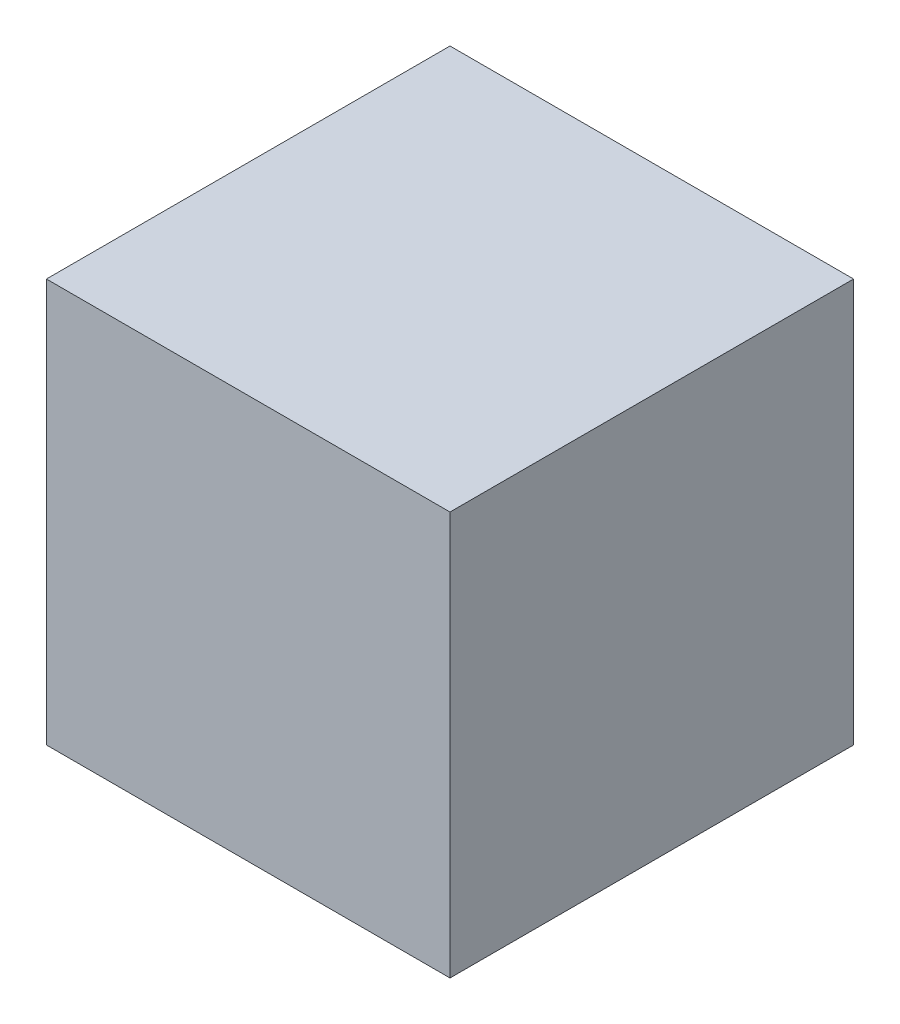
from build123d import *

# Parameters (mm, degrees)
SKETCH1_W           = 230
SKETCH1_H           = 230
BOSS_EXTRUDE1_DEPTH = 230


with BuildPart() as part:
    # Sketch1 → Boss-Extrude1 (new body)
    with BuildSketch(Plane(origin=(0, 0, 0), x_dir=(1, 0, 0), z_dir=(0, 1, 0))):
        Rectangle(SKETCH1_W, SKETCH1_H)
    extrude(amount=BOSS_EXTRUDE1_DEPTH)


solid = part.part
